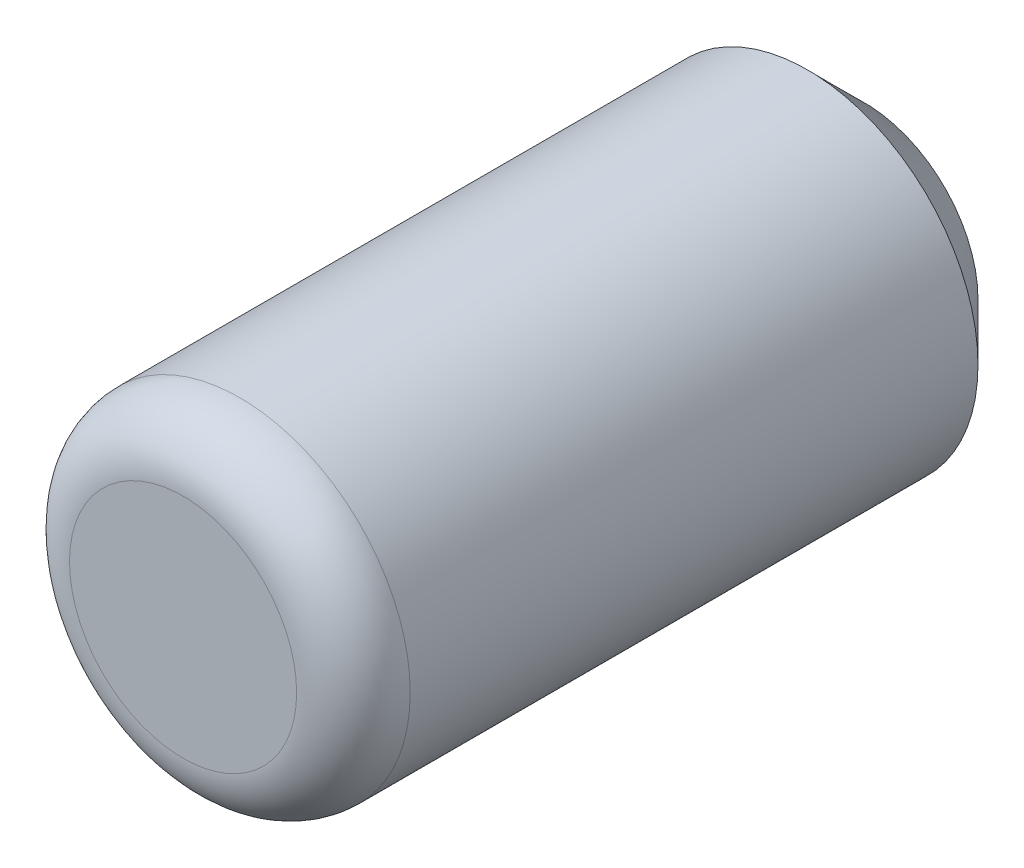
from build123d import *

# Parameters (mm, degrees)
SKETCH1_R      = 2.38125
EXTRUDE1_DEPTH = 4.7625
FILLET1_R      = 0.79375
CHAMFER1_SIZE  = 0.79375


with BuildPart() as part:
    # Sketch1 → Extrude1 (new, symmetric)
    with BuildSketch(Plane.XY):
        Circle(SKETCH1_R)
    extrude(amount=EXTRUDE1_DEPTH, both=True)

    # Fillet1
    fillet1_edges = [part.edges().sort_by_distance(p)[0] for p in [
        (-2.38125, 0, 4.7625),
    ]]
    fillet(fillet1_edges, radius=FILLET1_R)

    # Chamfer1
    chamfer1_edges = [part.edges().sort_by_distance(p)[0] for p in [
        (-2.38125, 0, -4.7625),
    ]]
    chamfer(chamfer1_edges, length=CHAMFER1_SIZE)


solid = part.part
